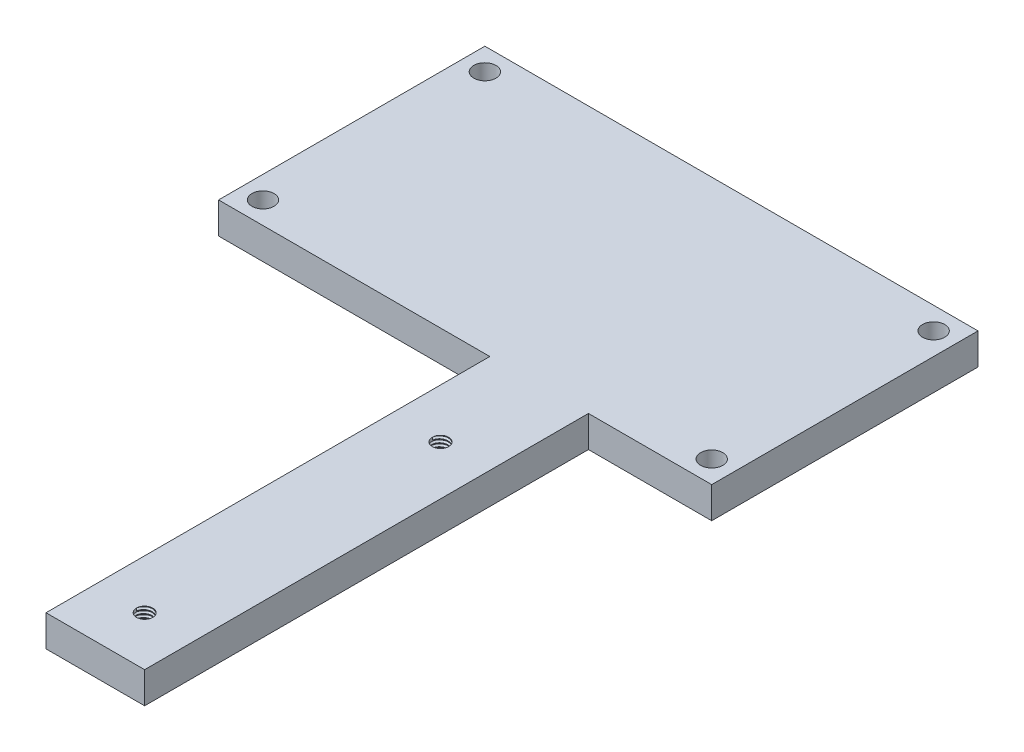
from build123d import *

# Parameters (mm, degrees)
BOSS_EXTRUDE1_DEPTH      = 3.175
BOSS_EXTRUDE1_DEPTH_BACK = 3.175
SKETCH1_R                = 2.25
SKETCH1_R_2              = 1.65
THREAD1_PITCH            = 0.7
THREAD2_PITCH            = 0.7


with BuildPart() as part:
    # Sketch1 → Boss-Extrude1 (new, two sides: drawn at the far end of the back side and taken through both)
    with BuildSketch(Plane(origin=(0, 0, 0), x_dir=(1, 0, 0), z_dir=(0, 1, 0)).offset(-BOSS_EXTRUDE1_DEPTH_BACK)):
        Polygon((-50, -27), (-50, 27), (50, 27), (50, -27), (25, -27), (25, -117), (5, -117), (5, -27), align=None)
        with Locations(Location((-45.5, 22.5, 0), (0, 0, 270))):
            Circle(SKETCH1_R, mode=Mode.SUBTRACT)
        with Locations(Location((45.5, 22.5, 0), (0, 0, 90))):
            Circle(SKETCH1_R, mode=Mode.SUBTRACT)
        with Locations(Location((45.5, -22.5, 0), (0, 0, 270))):
            Circle(SKETCH1_R, mode=Mode.SUBTRACT)
        with Locations(Location((-45.5, -22.5, 0), (0, 0, 90))):
            Circle(SKETCH1_R, mode=Mode.SUBTRACT)
        with Locations(Location((15, -47, 0), (0, 0, 270))):
            Circle(SKETCH1_R_2, mode=Mode.SUBTRACT)
        with Locations(Location((15, -107, 0), (0, 0, 270))):
            Circle(SKETCH1_R_2, mode=Mode.SUBTRACT)
    extrude(amount=BOSS_EXTRUDE1_DEPTH + BOSS_EXTRUDE1_DEPTH_BACK)

    # Thread1: the profile of Thread Profile1 profile screwed along a right-hand helix of 14.285714 turns, 6 arcs to a turn; built about Z, then put on its axis
    thread1_z = Axis((0, 0, 0), (0, 0, 1))
    thread1_corners = [(1.6497, 0, -0.000173205), (2.028886113, 0, 0.218749999), (2.028886113, 0, 0.306249999), (1.6497, 0, 0.525173203)]
    with BuildLine(mode=Mode.PRIVATE) as thread1_profile:
        Line(thread1_corners[0], thread1_corners[1])
        Line(thread1_corners[1], thread1_corners[2])
        Line(thread1_corners[2], thread1_corners[3])
        Line(thread1_corners[3], thread1_corners[0])
    thread1_cap = Face(thread1_profile.wire())
    thread1_turn_angles = [0, 30, 60, 90, 120, 150, 180, 210, 240, 270, 300, 330, 360]
    thread1_turn_weights = [1, 0.8660254037844387, 1, 0.8660254037844387, 1, 0.8660254037844387, 1, 0.8660254037844387, 1, 0.8660254037844387, 1, 0.8660254037844387, 1]
    thread1_turn_rails = [Edge.make_bspline([Vector(p[0], p[1], 0).rotate(thread1_z, thread1_turn_angles[k]) / thread1_turn_weights[k] + Vector(0, 0, p[2] + THREAD1_PITCH * thread1_turn_angles[k] / 360) for k in range(13)], [0, 0, 0, 1, 1, 2, 2, 3, 3, 4, 4, 5, 5, 6, 6, 6], 2, thread1_turn_weights) for p in thread1_corners]
    thread1_turn_sides = [Face.make_surface_from_curves(thread1_turn_rails[p[0]], thread1_turn_rails[p[1]]) for p in [(0, 1), (1, 2), (2, 3), (3, 0)]]
    thread1_last_angles = [5040, 5070, 5100, 5121.428571429, 5142.857142857]
    thread1_last_weights = [1, 0.8660254037844387, 1, 0.9308737486442035, 1]
    thread1_last_rails = [Edge.make_bspline([Vector(p[0], p[1], 0).rotate(thread1_z, thread1_last_angles[k]) / thread1_last_weights[k] + Vector(0, 0, p[2] + THREAD1_PITCH * thread1_last_angles[k] / 360) for k in range(5)], [0, 0, 0, 1, 1, 2, 2, 2], 2, thread1_last_weights) for p in thread1_corners]
    thread1_last_sides = [Face.make_surface_from_curves(thread1_last_rails[p[0]], thread1_last_rails[p[1]]) for p in [(0, 1), (1, 2), (2, 3), (3, 0)]]
    thread1 = Plane(origin=(15, 3.175, 47), x_dir=(-1, 0, 0), z_dir=(0, -1, 0)) * Solid(Shell([*[p.moved(Location((0, 0, THREAD1_PITCH * i))) for i in range(14) for p in thread1_turn_sides], *thread1_last_sides, thread1_cap, thread1_cap.rotate(thread1_z, 5142.857142857).moved(Location((0, 0, THREAD1_PITCH * 5142.857142857 / 360)))]))
    add(thread1, mode=Mode.SUBTRACT)

    # Thread2: the profile of Thread Profile2 profile screwed along a right-hand helix of 14.285714 turns, 6 arcs to a turn; built about Z, then put on its axis
    thread2_z = Axis((0, 0, 0), (0, 0, 1))
    thread2_corners = [(1.6497, 0, -0.000173205), (2.028886113, 0, 0.218749999), (2.028886113, 0, 0.306249999), (1.6497, 0, 0.525173203)]
    with BuildLine(mode=Mode.PRIVATE) as thread2_profile:
        Line(thread2_corners[0], thread2_corners[1])
        Line(thread2_corners[1], thread2_corners[2])
        Line(thread2_corners[2], thread2_corners[3])
        Line(thread2_corners[3], thread2_corners[0])
    thread2_cap = Face(thread2_profile.wire())
    thread2_turn_angles = [0, 30, 60, 90, 120, 150, 180, 210, 240, 270, 300, 330, 360]
    thread2_turn_weights = [1, 0.8660254037844387, 1, 0.8660254037844387, 1, 0.8660254037844387, 1, 0.8660254037844387, 1, 0.8660254037844387, 1, 0.8660254037844387, 1]
    thread2_turn_rails = [Edge.make_bspline([Vector(p[0], p[1], 0).rotate(thread2_z, thread2_turn_angles[k]) / thread2_turn_weights[k] + Vector(0, 0, p[2] + THREAD2_PITCH * thread2_turn_angles[k] / 360) for k in range(13)], [0, 0, 0, 1, 1, 2, 2, 3, 3, 4, 4, 5, 5, 6, 6, 6], 2, thread2_turn_weights) for p in thread2_corners]
    thread2_turn_sides = [Face.make_surface_from_curves(thread2_turn_rails[p[0]], thread2_turn_rails[p[1]]) for p in [(0, 1), (1, 2), (2, 3), (3, 0)]]
    thread2_last_angles = [5040, 5070, 5100, 5121.428571429, 5142.857142857]
    thread2_last_weights = [1, 0.8660254037844387, 1, 0.9308737486442035, 1]
    thread2_last_rails = [Edge.make_bspline([Vector(p[0], p[1], 0).rotate(thread2_z, thread2_last_angles[k]) / thread2_last_weights[k] + Vector(0, 0, p[2] + THREAD2_PITCH * thread2_last_angles[k] / 360) for k in range(5)], [0, 0, 0, 1, 1, 2, 2, 2], 2, thread2_last_weights) for p in thread2_corners]
    thread2_last_sides = [Face.make_surface_from_curves(thread2_last_rails[p[0]], thread2_last_rails[p[1]]) for p in [(0, 1), (1, 2), (2, 3), (3, 0)]]
    thread2 = Plane(origin=(15, 3.175, 107), x_dir=(-1, 0, 0), z_dir=(0, -1, 0)) * Solid(Shell([*[p.moved(Location((0, 0, THREAD2_PITCH * i))) for i in range(14) for p in thread2_turn_sides], *thread2_last_sides, thread2_cap, thread2_cap.rotate(thread2_z, 5142.857142857).moved(Location((0, 0, THREAD2_PITCH * 5142.857142857 / 360)))]))
    add(thread2, mode=Mode.SUBTRACT)


solid = part.part
